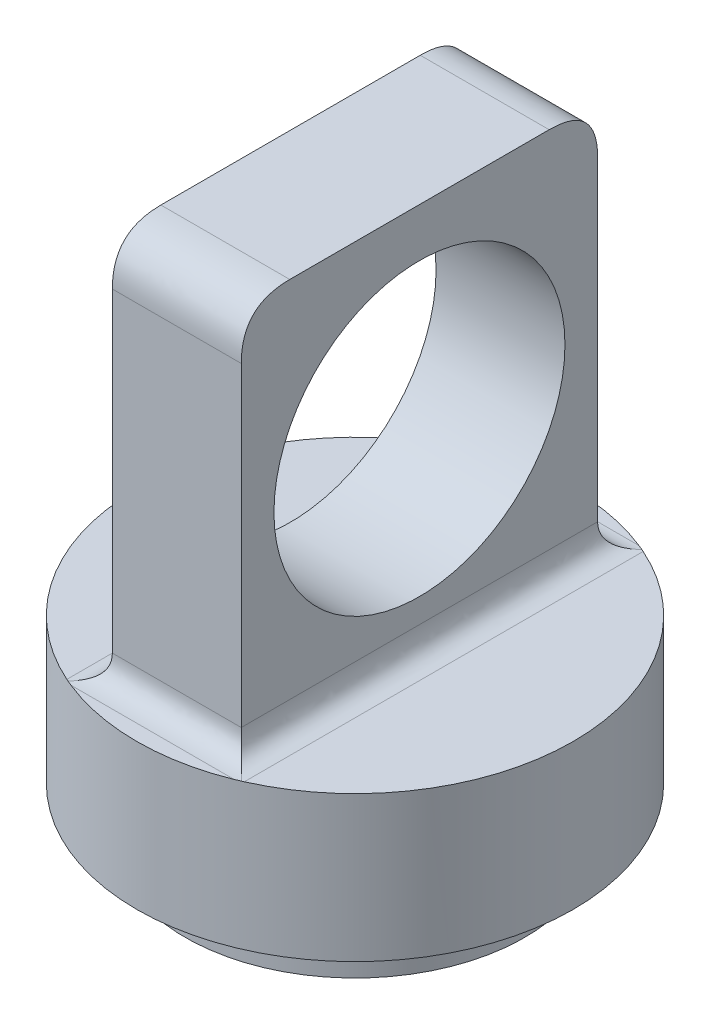
from build123d import *

# Parameters (mm, degrees)
SKETCH1_R           = 114.3
BOSS_EXTRUDE1_DEPTH = 76.2
SKETCH2_R           = 88.9
BOSS_EXTRUDE2_DEPTH = 25.4
SKETCH3_W           = 67.503621206
SKETCH3_H           = 186.628871474
BOSS_EXTRUDE3_DEPTH = 203.2
SKETCH4_R           = 76.2
CUT_EXTRUDE1_DEPTH  = 127
FILLET1_SIZE        = 25.4
FILLET2_SIZE        = 12.7


with BuildPart() as part:
    # Sketch1 → Boss-Extrude1 (new body)
    with BuildSketch(Plane(origin=(0, 0, 0), x_dir=(1, 0, 0), z_dir=(0, 1, 0))):
        with Locations(Location((0, 0, 0), (0, 0, 90))):
            Circle(SKETCH1_R)
    extrude(amount=BOSS_EXTRUDE1_DEPTH)

    # Sketch2 → Boss-Extrude2 (add)
    with BuildSketch(Plane(origin=(0, 0, 0), x_dir=(-1, 0, 0), z_dir=(0, -1, 0))):
        with Locations(Location((0, 0, 0), (0, 0, 90))):
            Circle(SKETCH2_R)
    extrude(amount=BOSS_EXTRUDE2_DEPTH)

    # Sketch3 → Boss-Extrude3 (add)
    with BuildSketch(Plane(origin=(0, 76.2, 0), x_dir=(1, 0, 0), z_dir=(0, 1, 0))):
        Rectangle(SKETCH3_W, SKETCH3_H)
    extrude(amount=BOSS_EXTRUDE3_DEPTH)

    # Sketch4 → Cut-Extrude1 (cut)
    with BuildSketch(Plane.ZY.offset(33.751810603)):
        with Locations((0, 177.8)):
            Circle(SKETCH4_R)
    extrude(amount=-CUT_EXTRUDE1_DEPTH, mode=Mode.SUBTRACT)

    # Fillet1
    # a fillet whose section is not a circle: 25.4 mm, written as the material it takes off along each edge
    with BuildSketch(Plane(origin=(97.251810603, 279.4, 93.314435737), x_dir=(0, -1, 0), z_dir=(-1, 0, 0)), Plane(origin=(-97.251810603, 279.4, -93.314435737), x_dir=(0, -1, 0), z_dir=(1, 0, 0))) as fillet1_piece_1:
        with BuildLine():
            Bezier((FILLET1_SIZE, 0), (0, 0), (0, -FILLET1_SIZE), weights=[1, 1, 1])
            Line((0, -FILLET1_SIZE), (0, 0))
            Line((0, 0), (FILLET1_SIZE, 0))
        make_face()
    extrude(amount=194.503621206, mode=Mode.SUBTRACT)

    # Fillet2
    # a fillet whose section is not a circle: 12.7 mm, written as the material it adds along each edge
    with BuildSketch(Plane(origin=(33.751810603, 76.2, 93.314435737), x_dir=(0, 0, 1), z_dir=(-1, 0, 0)), Plane(origin=(-33.751810603, 76.2, -93.314435737), x_dir=(0, 0, -1), z_dir=(1, 0, 0))) as fillet2_piece_1:
        with BuildLine():
            Bezier((FILLET2_SIZE, 0), (0, 0), (0, FILLET2_SIZE), weights=[1, 1, 1])
            Line((0, FILLET2_SIZE), (0, 0))
            Line((0, 0), (FILLET2_SIZE, 0))
        make_face()
    extrude(amount=67.503621206)
    with BuildSketch(Plane(origin=(-33.751810603, 76.2, 93.314435737), x_dir=(-1, 0, 0), z_dir=(0, 0, -1)), Plane(origin=(33.751810603, 76.2, -93.314435737), x_dir=(1, 0, 0), z_dir=(0, 0, 1))) as fillet2_piece_2:
        with BuildLine():
            Bezier((FILLET2_SIZE, 0), (0, 0), (0, FILLET2_SIZE), weights=[1, 1, 1])
            Line((0, FILLET2_SIZE), (0, 0))
            Line((0, 0), (FILLET2_SIZE, 0))
        make_face()
    extrude(amount=186.628871474)
    with BuildSketch(Plane(origin=(65.501810603, 76.2, 93.314435737), x_dir=(0, 0, 1), z_dir=(-1, 0, 0))) as fillet2_piece_3a_section:
        with BuildLine():
            Bezier((FILLET2_SIZE, 0), (0, 0), (0, FILLET2_SIZE), weights=[1, 1, 1])
            Line((0, FILLET2_SIZE), (0, 0))
            Line((0, 0), (FILLET2_SIZE, 0))
        make_face()
    fillet2_piece_3a = extrude(amount=99.253621206, mode=Mode.PRIVATE)
    fillet2_piece_3a = fillet2_piece_3a & Plane(origin=(0, 76.2, 0), x_dir=(0, 0, -1), z_dir=(0, -1, 0)) * Cylinder(114.3, 250, mode=Mode.PRIVATE)
    fillet2_piece_3a = split(fillet2_piece_3a, bisect_by=Plane(origin=(33.751810603, 76.2, 93.314435737), z_dir=(1, 0, 0)), keep=Keep.TOP, mode=Mode.PRIVATE)
    with BuildSketch(Plane(origin=(33.751810603, 76.2, -93.314435737), x_dir=(1, 0, 0), z_dir=(0, 0, 1))) as fillet2_piece_3b_section:
        with BuildLine():
            Bezier((FILLET2_SIZE, 0), (0, 0), (0, FILLET2_SIZE), weights=[1, 1, 1])
            Line((0, FILLET2_SIZE), (0, 0))
            Line((0, 0), (FILLET2_SIZE, 0))
        make_face()
    fillet2_piece_3b = extrude(amount=218.378871474, mode=Mode.PRIVATE)
    fillet2_piece_3b = fillet2_piece_3b & Plane(origin=(0, 76.2, 0), x_dir=(0, 0, -1), z_dir=(0, -1, 0)) * Cylinder(114.3, 488, mode=Mode.PRIVATE)
    fillet2_piece_3b = split(fillet2_piece_3b, bisect_by=Plane(origin=(33.751810603, 76.2, 93.314435737), z_dir=(0, 0, 1)), keep=Keep.TOP, mode=Mode.PRIVATE)
    fillet2_piece_3 = fillet2_piece_3a & fillet2_piece_3b
    add(fillet2_piece_3)
    with BuildSketch(Plane(origin=(-33.751810603, 76.2, 125.064435737), x_dir=(-1, 0, 0), z_dir=(0, 0, -1))) as fillet2_piece_4a_section:
        with BuildLine():
            Bezier((FILLET2_SIZE, 0), (0, 0), (0, FILLET2_SIZE), weights=[1, 1, 1])
            Line((0, FILLET2_SIZE), (0, 0))
            Line((0, 0), (FILLET2_SIZE, 0))
        make_face()
    fillet2_piece_4a = extrude(amount=218.378871474, mode=Mode.PRIVATE)
    fillet2_piece_4a = fillet2_piece_4a & Plane(origin=(0, 76.2, 0), x_dir=(0, 0, -1), z_dir=(0, -1, 0)) * Cylinder(114.3, 488, mode=Mode.PRIVATE)
    fillet2_piece_4a = split(fillet2_piece_4a, bisect_by=Plane(origin=(-33.751810603, 76.2, 93.314435737), z_dir=(0, 0, 1)), keep=Keep.TOP, mode=Mode.PRIVATE)
    with BuildSketch(Plane(origin=(33.751810603, 76.2, 93.314435737), x_dir=(0, 0, 1), z_dir=(-1, 0, 0))) as fillet2_piece_4b_section:
        with BuildLine():
            Bezier((FILLET2_SIZE, 0), (0, 0), (0, FILLET2_SIZE), weights=[1, 1, 1])
            Line((0, FILLET2_SIZE), (0, 0))
            Line((0, 0), (FILLET2_SIZE, 0))
        make_face()
    fillet2_piece_4b = extrude(amount=99.253621206, mode=Mode.PRIVATE)
    fillet2_piece_4b = fillet2_piece_4b & Plane(origin=(0, 76.2, 0), x_dir=(0, 0, -1), z_dir=(0, -1, 0)) * Cylinder(114.3, 250, mode=Mode.PRIVATE)
    fillet2_piece_4b = split(fillet2_piece_4b, bisect_by=Plane(origin=(-33.751810603, 76.2, 93.314435737), z_dir=(-1, 0, 0)), keep=Keep.TOP, mode=Mode.PRIVATE)
    fillet2_piece_4 = fillet2_piece_4a & fillet2_piece_4b
    add(fillet2_piece_4)
    with BuildSketch(Plane(origin=(-33.751810603, 76.2, 93.314435737), x_dir=(-1, 0, 0), z_dir=(0, 0, -1))) as fillet2_piece_5a_section:
        with BuildLine():
            Bezier((FILLET2_SIZE, 0), (0, 0), (0, FILLET2_SIZE), weights=[1, 1, 1])
            Line((0, FILLET2_SIZE), (0, 0))
            Line((0, 0), (FILLET2_SIZE, 0))
        make_face()
    fillet2_piece_5a = extrude(amount=218.378871474, mode=Mode.PRIVATE)
    fillet2_piece_5a = fillet2_piece_5a & Plane(origin=(0, 76.2, 0), x_dir=(0, 0, -1), z_dir=(0, -1, 0)) * Cylinder(114.3, 488, mode=Mode.PRIVATE)
    fillet2_piece_5a = split(fillet2_piece_5a, bisect_by=Plane(origin=(-33.751810603, 76.2, -93.314435737), z_dir=(0, 0, -1)), keep=Keep.TOP, mode=Mode.PRIVATE)
    with BuildSketch(Plane(origin=(-65.501810603, 76.2, -93.314435737), x_dir=(0, 0, -1), z_dir=(1, 0, 0))) as fillet2_piece_5b_section:
        with BuildLine():
            Bezier((FILLET2_SIZE, 0), (0, 0), (0, FILLET2_SIZE), weights=[1, 1, 1])
            Line((0, FILLET2_SIZE), (0, 0))
            Line((0, 0), (FILLET2_SIZE, 0))
        make_face()
    fillet2_piece_5b = extrude(amount=99.253621206, mode=Mode.PRIVATE)
    fillet2_piece_5b = fillet2_piece_5b & Plane(origin=(0, 76.2, 0), x_dir=(0, 0, -1), z_dir=(0, -1, 0)) * Cylinder(114.3, 250, mode=Mode.PRIVATE)
    fillet2_piece_5b = split(fillet2_piece_5b, bisect_by=Plane(origin=(-33.751810603, 76.2, -93.314435737), z_dir=(-1, 0, 0)), keep=Keep.TOP, mode=Mode.PRIVATE)
    fillet2_piece_5 = fillet2_piece_5a & fillet2_piece_5b
    add(fillet2_piece_5)
    with BuildSketch(Plane(origin=(33.751810603, 76.2, -125.064435737), x_dir=(1, 0, 0), z_dir=(0, 0, 1))) as fillet2_piece_6a_section:
        with BuildLine():
            Bezier((FILLET2_SIZE, 0), (0, 0), (0, FILLET2_SIZE), weights=[1, 1, 1])
            Line((0, FILLET2_SIZE), (0, 0))
            Line((0, 0), (FILLET2_SIZE, 0))
        make_face()
    fillet2_piece_6a = extrude(amount=218.378871474, mode=Mode.PRIVATE)
    fillet2_piece_6a = fillet2_piece_6a & Plane(origin=(0, 76.2, 0), x_dir=(0, 0, -1), z_dir=(0, -1, 0)) * Cylinder(114.3, 488, mode=Mode.PRIVATE)
    fillet2_piece_6a = split(fillet2_piece_6a, bisect_by=Plane(origin=(33.751810603, 76.2, -93.314435737), z_dir=(0, 0, -1)), keep=Keep.TOP, mode=Mode.PRIVATE)
    with BuildSketch(Plane(origin=(-33.751810603, 76.2, -93.314435737), x_dir=(0, 0, -1), z_dir=(1, 0, 0))) as fillet2_piece_6b_section:
        with BuildLine():
            Bezier((FILLET2_SIZE, 0), (0, 0), (0, FILLET2_SIZE), weights=[1, 1, 1])
            Line((0, FILLET2_SIZE), (0, 0))
            Line((0, 0), (FILLET2_SIZE, 0))
        make_face()
    fillet2_piece_6b = extrude(amount=99.253621206, mode=Mode.PRIVATE)
    fillet2_piece_6b = fillet2_piece_6b & Plane(origin=(0, 76.2, 0), x_dir=(0, 0, -1), z_dir=(0, -1, 0)) * Cylinder(114.3, 250, mode=Mode.PRIVATE)
    fillet2_piece_6b = split(fillet2_piece_6b, bisect_by=Plane(origin=(33.751810603, 76.2, -93.314435737), z_dir=(1, 0, 0)), keep=Keep.TOP, mode=Mode.PRIVATE)
    fillet2_piece_6 = fillet2_piece_6a & fillet2_piece_6b
    add(fillet2_piece_6)


solid = part.part
